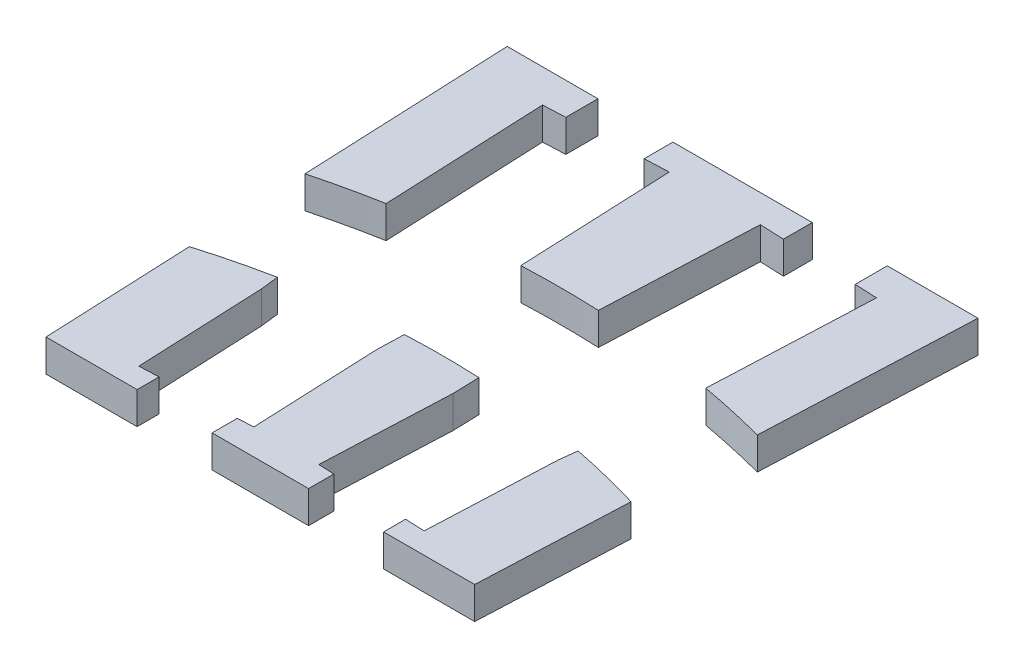
from build123d import *

# Parameters (mm, degrees)
BOSS_EXTRUDE1_DEPTH      = 3
CUT_EXTRUDE1_DEPTH       = 103.427778996
BOSS_EXTRUDE2_DEPTH      = 3
CUT_EXTRUDE5_DEPTH       = 103.427778996
MIRROR4_DEPTH            = 3
CUT_EXTRUDE7_DEPTH       = 103.427778996
CUT_EXTRUDE7_DEPTH_BACK  = 103.427778996
CUT_EXTRUDE8_DEPTH       = 103.427778996
CUT_EXTRUDE8_DEPTH_BACK  = 103.427778996
CUT_EXTRUDE9_DEPTH       = 103.427778996
CUT_EXTRUDE9_DEPTH_BACK  = 103.427778996
CUT_EXTRUDE10_DEPTH      = 103.427778996
CUT_EXTRUDE10_DEPTH_BACK = 103.427778996


# Read off the part's stored shape, not the designer's step: Mirror4
with BuildPart() as part:
    # Sketch1 → Boss-Extrude1 (new body)
    with BuildSketch(Plane(origin=(0, 0, 0), x_dir=(1, 0, 0), z_dir=(0, 1, 0))):
        Polygon((-21.964742431, 100), (-20, 55), (0, 55), (0, 100), align=None)
    extrude(amount=BOSS_EXTRUDE1_DEPTH)

    # Sketch2 → Cut-Extrude1 (cut, symmetric)
    with BuildSketch(Plane(origin=(0, 3, 0), x_dir=(1, 0, 0), z_dir=(0, 1, 0))):
        Polygon((-13.837321606, 56.950628888), (-2.508114774, 57.445272741), (-4.252890268, 97.407201604), (-15.582097101, 96.912557752), align=None)
    extrude(amount=CUT_EXTRUDE1_DEPTH, both=True, mode=Mode.SUBTRACT)

    # Sketch6 → Boss-Extrude2 (add)
    with BuildSketch(Plane(origin=(0, 3, 0), x_dir=(1, 0, 0), z_dir=(0, 1, 0))):
        Polygon((-13.837321606, 56.950628888), (-13.31282129, 56.973529067), (-13.836253938, 68.962107726), (-14.666089966, 75.932545098), align=None)
    boss_extrude2 = extrude(amount=-BOSS_EXTRUDE2_DEPTH)

    # Mirror3: Boss-Extrude2 across plane
    add(boss_extrude2.mirror(Plane(origin=(-5.664603416, 0, 0.247321926), x_dir=(0.043619387365336264, 0, 0.9990482215818577), z_dir=(0.9990482215818578, 0, -0.043619387365336264))))

    # Sketch11 → Cut-Extrude5 (cut, symmetric)
    with BuildSketch(Plane(origin=(0, 3, 0), x_dir=(1, 0, 0), z_dir=(0, 1, 0))):
        with BuildLine():
            Line((-21.103413479, 80.272323621), (-20.610683569, 68.98695328))
            ThreePointArc((-20.610683569, 68.98695328), (-10.414877912, 71.24275625), (0, 72))
            Line((0, 72), (0, 83))
            ThreePointArc((0, 83), (-10.639481647, 82.315256364), (-21.103413479, 80.272323621))
        make_face()
    extrude(amount=CUT_EXTRUDE5_DEPTH, both=True, mode=Mode.SUBTRACT)


with BuildPart() as cut_extrude5_piece_1:
    # of the separate pieces the step leaves, piece 1, a body of its own (cut_extrude5_pieces)
    add(part.part.solids().sort_by_distance((-21.964742431, 0, -100))[0])



with BuildPart() as cut_extrude5_piece_2:
    # of the separate pieces the step leaves, piece 2, a body of its own (cut_extrude5_pieces)
    add(part.part.solids().sort_by_distance((-20.610683569, 0, -68.98695328))[0])


with BuildPart() as cut_extrude5_piece_1_1:
    add(cut_extrude5_piece_1.part)

    add(cut_extrude5_piece_2.part)  # Mirror4 merges Cut-Extrude5 piece 2
    # Mirror4 outline → Mirror4 (add)
    with BuildSketch(Plane(origin=(0, 0, 0), x_dir=(1, 0, 0), z_dir=(0, 1, 0))):
        with BuildLine():
            Line((21.964742431, 100), (0, 100))
            Line((0, 100), (0, 83))
            ThreePointArc((0, 83), (1.810635458, 82.980248248), (3.620409151, 82.921002391))
            Line((3.620409151, 82.921002391), (4.252890268, 97.407201604))
            Line((4.252890268, 97.407201604), (15.582097101, 96.912557752))
            Line((15.582097101, 96.912557752), (14.915666073, 81.648777735))
            ThreePointArc((14.915666073, 81.648777735), (18.022685133, 81.019644658), (21.103413479, 80.272323621))
            Line((21.103413479, 80.272323621), (21.964742431, 100))
        make_face()
        with BuildLine():
            Line((20, 55), (20.610683569, 68.98695328))
            ThreePointArc((20.610683569, 68.98695328), (17.341316245, 69.880460437), (14.033522659, 70.619120936))
            Line((14.033522659, 70.619120936), (13.836253938, 68.962107726))
            Line((13.836253938, 68.962107726), (13.31282129, 56.973529067))
            Line((13.31282129, 56.973529067), (3.03261509, 57.422372563))
            Line((3.03261509, 57.422372563), (3.556047738, 69.410951222))
            Line((3.556047738, 69.410951222), (3.47779944, 71.915957277))
            ThreePointArc((3.47779944, 71.915957277), (1.739407379, 71.978986253), (0, 72))
            Line((0, 72), (0, 55))
            Line((0, 55), (20, 55))
        make_face()
    extrude(amount=MIRROR4_DEPTH)

    # Sketch7 → Cut-Extrude7 (cut, two sides: drawn at the far end of the back side and taken through both)
    with BuildSketch(Plane(origin=(0, 3, 0), x_dir=(1, 0, 0), z_dir=(0, 1, 0)).offset(-CUT_EXTRUDE7_DEPTH_BACK)):
        Polygon((-13.5, 100), (-13.5, 97.003464074), (-6.5, 97.309090675), (-6.5, 100), align=None)
    extrude(amount=CUT_EXTRUDE7_DEPTH + CUT_EXTRUDE7_DEPTH_BACK, mode=Mode.SUBTRACT)

    # Sketch13 → Cut-Extrude8 (cut, two sides: drawn at the far end of the back side and taken through both)
    with BuildSketch(Plane(origin=(0, 3, 0), x_dir=(1, 0, 0), z_dir=(0, 1, 0)).offset(-CUT_EXTRUDE8_DEPTH_BACK)):
        Polygon((6.5, 97.309090675), (6.5, 100), (13.5, 100), (13.5, 97.003464074), align=None)
    extrude(amount=CUT_EXTRUDE8_DEPTH + CUT_EXTRUDE8_DEPTH_BACK, mode=Mode.SUBTRACT)

    # Sketch14 → Cut-Extrude9 (cut, two sides: drawn at the far end of the back side and taken through both)
    with BuildSketch(Plane(origin=(0, 3, 0), x_dir=(1, 0, 0), z_dir=(0, 1, 0)).offset(-CUT_EXTRUDE9_DEPTH_BACK)):
        Polygon((-11.5, 57.052678553), (-11.5, 55), (-4.5, 55), (-4.5, 57.358305154), align=None)
    extrude(amount=CUT_EXTRUDE9_DEPTH + CUT_EXTRUDE9_DEPTH_BACK, mode=Mode.SUBTRACT)

    # Sketch15 → Cut-Extrude10 (cut, two sides: drawn at the far end of the back side and taken through both)
    with BuildSketch(Plane(origin=(0, 3, 0), x_dir=(1, 0, 0), z_dir=(0, 1, 0)).offset(-CUT_EXTRUDE10_DEPTH_BACK)):
        Polygon((4.5, 57.358305154), (4.5, 55), (11.5, 55), (11.5, 57.052678553), align=None)
    extrude(amount=CUT_EXTRUDE10_DEPTH + CUT_EXTRUDE10_DEPTH_BACK, mode=Mode.SUBTRACT)


solid = cut_extrude5_piece_1_1.part
